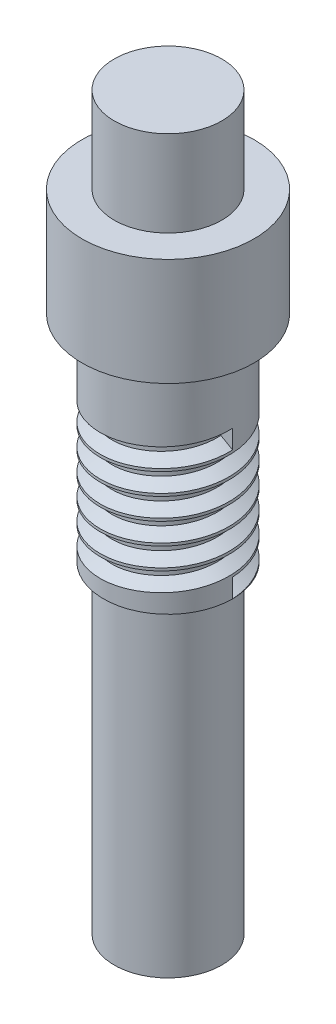
from build123d import *

# Parameters (mm, degrees)
SKETCH1_R           = 4
BOSS_EXTRUDE1_DEPTH = 30
SKETCH8_R           = 4
SKETCH8_R_2         = 3
CUT_EXTRUDE2_DEPTH  = 25
SKETCH15_R          = 3
SKETCH15_R_2        = 2.5
CUT_EXTRUDE3_DEPTH  = 15
THREAD1_PITCH       = 1
SKETCH18_R          = 2.5
BOSS_EXTRUDE2_DEPTH = 4


with BuildPart() as part:
    # Sketch1 → Boss-Extrude1 (new body)
    with BuildSketch(Plane(origin=(0, 0, 0), x_dir=(1, 0, 0), z_dir=(0, 1, 0))):
        with Locations(Location((0, 0, 0), (0, 0, 270))):
            Circle(SKETCH1_R)
    extrude(amount=BOSS_EXTRUDE1_DEPTH)

    # Sketch8 → Cut-Extrude2 (cut)
    with BuildSketch(Plane.XZ):
        with Locations(Location((0, 0, 0), (0, 0, 270))):
            Circle(SKETCH8_R)
        with Locations(Location((0, 0, 0), (0, 0, 270))):
            Circle(SKETCH8_R_2, mode=Mode.SUBTRACT)
    extrude(amount=-CUT_EXTRUDE2_DEPTH, mode=Mode.SUBTRACT)

    # Sketch15 → Cut-Extrude3 (cut)
    with BuildSketch(Plane.XZ):
        with Locations(Location((0, 0, 0), (0, 0, 270))):
            Circle(SKETCH15_R)
        with Locations(Location((0, 0, 0), (0, 0, 270))):
            Circle(SKETCH15_R_2, mode=Mode.SUBTRACT)
    extrude(amount=-CUT_EXTRUDE3_DEPTH, mode=Mode.SUBTRACT)

    # Thread1: the profile of Thread Profile1 profile screwed along a right-hand helix of 6 turns, 8 arcs to a turn; built about Z, then put on its axis
    thread1_z = Axis((0, 0, 0), (0, 0, 1))
    thread1_corners = [(3.0003, 0, -0.000173205), (3.0003, 0, 0.875173202), (2.458734125, 0, 0.562499999), (2.458734125, 0, 0.312499999)]
    with BuildLine(mode=Mode.PRIVATE) as thread1_profile:
        Line(thread1_corners[0], thread1_corners[1])
        Line(thread1_corners[1], thread1_corners[2])
        Line(thread1_corners[2], thread1_corners[3])
        Line(thread1_corners[3], thread1_corners[0])
    thread1_cap = Face(thread1_profile.wire())
    thread1_turn_angles = [0, 22.5, 45, 67.5, 90, 112.5, 135, 157.5, 180, 202.5, 225, 247.5, 270, 292.5, 315, 337.5, 360]
    thread1_turn_weights = [1, 0.9238795325112867, 1, 0.9238795325112867, 1, 0.9238795325112867, 1, 0.9238795325112867, 1, 0.9238795325112867, 1, 0.9238795325112867, 1, 0.9238795325112867, 1, 0.9238795325112867, 1]
    thread1_turn_rails = [Edge.make_bspline([Vector(p[0], p[1], 0).rotate(thread1_z, thread1_turn_angles[k]) / thread1_turn_weights[k] + Vector(0, 0, p[2] + THREAD1_PITCH * thread1_turn_angles[k] / 360) for k in range(17)], [0, 0, 0, 1, 1, 2, 2, 3, 3, 4, 4, 5, 5, 6, 6, 7, 7, 8, 8, 8], 2, thread1_turn_weights) for p in thread1_corners]
    thread1_turn_sides = [Face.make_surface_from_curves(thread1_turn_rails[p[0]], thread1_turn_rails[p[1]]) for p in [(0, 1), (1, 2), (2, 3), (3, 0)]]
    thread1_turn = Solid(Shell([*thread1_turn_sides, thread1_cap, thread1_cap.rotate(thread1_z, 360).moved(Location((0, 0, THREAD1_PITCH * 360 / 360)))]))
    thread1_each = [*[thread1_turn.moved(Location((0, 0, THREAD1_PITCH * i))) for i in range(6)]]
    add(Plane(origin=(0, 15, 0), x_dir=(1, 0, 0), z_dir=(0, 1, 0)) * Compound([thread1_each[i] for i in range(0, 6, 2)]), mode=Mode.SUBTRACT)
    add(Plane(origin=(0, 15, 0), x_dir=(1, 0, 0), z_dir=(0, 1, 0)) * Compound([thread1_each[i] for i in range(1, 6, 2)]), mode=Mode.SUBTRACT)

    # Sketch18 → Boss-Extrude2 (add)
    with BuildSketch(Plane(origin=(0, 30, 0), x_dir=(1, 0, 0), z_dir=(0, 1, 0))):
        with Locations(Location((0, 0, 0), (0, 0, 90))):
            Circle(SKETCH18_R)
    extrude(amount=BOSS_EXTRUDE2_DEPTH)


solid = part.part
